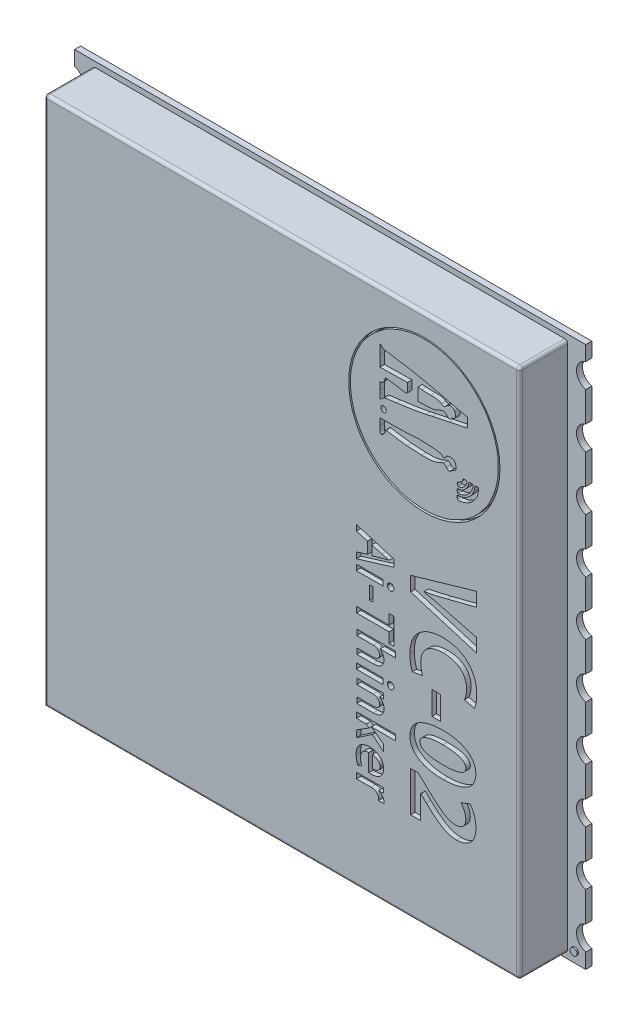
from build123d import *

# Parameters (mm, degrees)
BOSS_EXTRU_1_DEPTH      = 0.2
ESQUISSE2_W             = 15.803114296
ESQUISSE2_H             = 17.642374152
BOSS_EXTRU_2_DEPTH      = 1.6
CONG_1_R                = 0.1
ESQUISSE3_R             = 0.116493482
BOSS_EXTRU_3_DEPTH      = 0.05
ESQUISSE4_R             = 2.51604022
ENL_V_MAT_EXTRU_1_DEPTH = 0.15
ESQUISSE5_W             = 0.778452864
ESQUISSE5_H             = 0.285159829
ENL_V_MAT_EXTRU_2_DEPTH = 0.15
ESQUISSE6_W             = 0.190537595
ESQUISSE6_H             = 0.895310767
ESQUISSE6_W_2           = 0.446033444
ESQUISSE6_H_2           = 0.118264801
ENL_V_MAT_EXTRU_3_DEPTH = 0.15


with BuildPart() as part:
    # Esquisse1 → Boss.-Extru.1 (new body)
    with BuildSketch(Plane.XY):
        with BuildLine():
            Line((-8.5, -9), (8.5, -9))
            Line((8.5, -9), (8.5, -8.495815854))
            ThreePointArc((8.5, -8.495815854), (8.192365076, -8.092917147), (8.5, -7.690018439))
            Line((8.5, -7.690018439), (8.5, -6.695815854))
            ThreePointArc((8.5, -6.695815854), (8.192365076, -6.292917147), (8.5, -5.890018439))
            Line((8.5, -5.890018439), (8.5, -4.895815854))
            ThreePointArc((8.5, -4.895815854), (8.192365076, -4.492917147), (8.5, -4.090018439))
            Line((8.5, -4.090018439), (8.5, -3.095815854))
            ThreePointArc((8.5, -3.095815854), (8.192365076, -2.692917147), (8.5, -2.290018439))
            Line((8.5, -2.290018439), (8.5, -1.295815854))
            ThreePointArc((8.5, -1.295815854), (8.192365076, -0.892917147), (8.5, -0.490018439))
            Line((8.5, -0.490018439), (8.5, 0.504184146))
            ThreePointArc((8.5, 0.504184146), (8.192365076, 0.907082853), (8.5, 1.309981561))
            Line((8.5, 1.309981561), (8.5, 2.304184146))
            ThreePointArc((8.5, 2.304184146), (8.192365076, 2.707082853), (8.5, 3.109981561))
            Line((8.5, 3.109981561), (8.5, 4.104184146))
            ThreePointArc((8.5, 4.104184146), (8.192365076, 4.507082853), (8.5, 4.909981561))
            Line((8.5, 4.909981561), (8.5, 5.904184146))
            ThreePointArc((8.5, 5.904184146), (8.192365076, 6.307082853), (8.5, 6.709981561))
            Line((8.5, 6.709981561), (8.5, 7.704184146))
            ThreePointArc((8.5, 7.704184146), (8.192365076, 8.107082853), (8.5, 8.509981561))
            Line((8.5, 8.509981561), (8.5, 9))
            Line((8.5, 9), (-8.5, 9))
            Line((-8.5, 9), (-8.5, 8.509981561))
            ThreePointArc((-8.5, 8.509981561), (-8.192365076, 8.107082853), (-8.5, 7.704184146))
            Line((-8.5, 7.704184146), (-8.5, 6.709981561))
            ThreePointArc((-8.5, 6.709981561), (-8.192365076, 6.307082853), (-8.5, 5.904184146))
            Line((-8.5, 5.904184146), (-8.5, 4.909981561))
            ThreePointArc((-8.5, 4.909981561), (-8.192365076, 4.507082853), (-8.5, 4.104184146))
            Line((-8.5, 4.104184146), (-8.5, 3.109981561))
            ThreePointArc((-8.5, 3.109981561), (-8.192365076, 2.707082853), (-8.5, 2.304184146))
            Line((-8.5, 2.304184146), (-8.5, 1.309981561))
            ThreePointArc((-8.5, 1.309981561), (-8.192365076, 0.907082853), (-8.5, 0.504184146))
            Line((-8.5, 0.504184146), (-8.5, -0.490018439))
            ThreePointArc((-8.5, -0.490018439), (-8.192365076, -0.892917147), (-8.5, -1.295815854))
            Line((-8.5, -1.295815854), (-8.5, -2.290018439))
            ThreePointArc((-8.5, -2.290018439), (-8.192365076, -2.692917147), (-8.5, -3.095815854))
            Line((-8.5, -3.095815854), (-8.5, -4.090018439))
            ThreePointArc((-8.5, -4.090018439), (-8.192365076, -4.492917147), (-8.5, -4.895815854))
            Line((-8.5, -4.895815854), (-8.5, -5.890018439))
            ThreePointArc((-8.5, -5.890018439), (-8.192365076, -6.292917147), (-8.5, -6.695815854))
            Line((-8.5, -6.695815854), (-8.5, -7.690018439))
            ThreePointArc((-8.5, -7.690018439), (-8.192365076, -8.092917147), (-8.5, -8.495815854))
            Line((-8.5, -8.495815854), (-8.5, -9))
        make_face()
    extrude(amount=BOSS_EXTRU_1_DEPTH)

    # Esquisse2 → Boss.-Extru.2 (add)
    with BuildSketch(Plane.XY.offset(0.2)):
        Rectangle(ESQUISSE2_W, ESQUISSE2_H)
    extrude(amount=BOSS_EXTRU_2_DEPTH)

    # Congé1
    cong_1_edges = [part.edges().sort_by_distance(p)[0] for p in [
        (7.901557148, -8.821187076, 1),
        (-7.901557148, 8.821187076, 1),
        (7.901557148, 8.821187076, 1),
        (0, 8.821187076, 1.8),
        (7.901557148, 0, 1.8),
        (0, -8.821187076, 1.8),
        (-7.901557148, 0, 1.8),
    ]]
    fillet(cong_1_edges, radius=CONG_1_R)

    # Esquisse3 → Boss.-Extru.3 (add)
    with BuildSketch(Plane.XY.offset(0.2)):
        with Locations((8.142946919, -8.644375793)):
            Circle(ESQUISSE3_R)
    extrude(amount=BOSS_EXTRU_3_DEPTH)

    # Esquisse4 → Enlèv. mat.-Extru.1 (cut)
    # profile 1 of 7: a face of its own
    with BuildSketch(Plane(origin=(4.077832709, 3.569616169, 1.8), x_dir=(0, -1, 0), z_dir=(0, 0, 1))):
        with Locations((-2.032866157, 0.653421265)):
            Circle(ESQUISSE4_R)
        with BuildLine():
            add(Edge.make_bspline(
                [(-1.438084741, -1.726497797), (-1.667747991, -1.793112797), (-1.984358491, -1.819272047), (-2.266952991, -1.794980797)],
                knots=[0, 0, 0, 0, 1, 1, 1, 1], degree=3))
            add(Edge.make_bspline(
                [(-2.266952991, -1.794980797), (-2.410836491, -1.782613047), (-2.488838491, -1.768228547), (-2.734293491, -1.708798047)],
                knots=[0, 0, 0, 0, 1, 1, 1, 1], degree=3))
            add(Edge.make_bspline(
                [(-2.734293491, -1.708798047), (-2.884789741, -1.672359547), (-3.279960241, -1.489848797), (-3.395100741, -1.403602297)],
                knots=[0, 0, 0, 0, 1, 1, 1, 1], degree=3))
            add(Edge.make_bspline(
                [(-3.395100741, -1.403602297), (-3.423911241, -1.382021797), (-3.499302991, -1.325549047), (-3.562637741, -1.278107797)],
                knots=[0, 0, 0, 0, 1, 1, 1, 1], degree=3))
            add(Edge.make_bspline(
                [(-3.562637741, -1.278107797), (-3.717159991, -1.162362297), (-3.883622241, -0.990693047), (-4.017665991, -0.808846797)],
                knots=[0, 0, 0, 0, 1, 1, 1, 1], degree=3))
            add(Edge.make_bspline(
                [(-4.017665991, -0.808846797), (-4.078438991, -0.726400797), (-4.135252741, -0.650105547), (-4.143918241, -0.639301547)],
                knots=[0, 0, 0, 0, 1, 1, 1, 1], degree=3))
            add(Edge.make_bspline(
                [(-4.143918241, -0.639301547), (-4.175609241, -0.599790547), (-4.336371741, -0.250348547), (-4.370166741, -0.147515797)],
                knots=[0, 0, 0, 0, 1, 1, 1, 1], degree=3))
            add(Edge.make_bspline(
                [(-4.370166741, -0.147515797), (-4.476968491, 0.177464203), (-4.502132741, 0.330473953), (-4.502132741, 0.979324203), (-4.476968491, 1.132334203), (-4.370166741, 1.457314203)],
                knots=[0, 0, 0, 0, 1, 1, 1.999999229, 1.999999229, 1.999999229, 1.999999229], degree=3))
            add(Edge.make_bspline(
                [(-4.370166741, 1.457314203), (-4.328578241, 1.583861203), (-4.169041241, 1.920901453), (-4.120718741, 1.969223953), (-4.100542991, 1.997548703), (-4.089434991, 2.018616203)],
                knots=[0, 0, 0, 0, 1, 1, 1.389735699, 1.389735699, 1.389735699, 1.389735699], degree=3))
            add(Edge.make_bspline(
                [(-4.089434991, 2.018616203), (-3.994602741, 2.198479953), (-3.590090241, 2.602992703), (-3.410226491, 2.697825203)],
                knots=[0, 0, 0, 0, 1, 1, 1, 1], degree=3))
            add(Edge.make_bspline(
                [(-3.410226491, 2.697825203), (-3.389158741, 2.708932703), (-3.360833991, 2.729108703), (-3.312511741, 2.777430953), (-2.975471241, 2.936967953), (-2.848924241, 2.978556703)],
                knots=[0, 0, 0, 0, 1, 1, 3.56575719, 3.56575719, 3.56575719, 3.56575719], degree=3))
            add(Edge.make_bspline(
                [(-2.848924241, 2.978556703), (-2.523944191, 3.0853583), (-2.370934429, 3.110522477), (-2.046509429, 3.110522324)],
                knots=[0, 0, 0, 0, 1, 1, 1, 1], degree=3))
            add(Edge.make_bspline(
                [(-2.046509429, 3.110522324), (-1.722084179, 3.110522188), (-1.569074189, 3.085357874), (-1.244094484, 2.978555988)],
                knots=[0, 0, 0, 0, 1, 1, 1, 1], degree=3))
            add(Edge.make_bspline(
                [(-1.244094484, 2.978555988), (-1.141261484, 2.944760738), (-0.791819484, 2.783998238), (-0.752308734, 2.752307488)],
                knots=[0, 0, 0, 0, 1, 1, 1, 1], degree=3))
            add(Edge.make_bspline(
                [(-0.752308734, 2.752307488), (-0.741504734, 2.743641738), (-0.665209234, 2.686828238), (-0.582763234, 2.626055238)],
                knots=[0, 0, 0, 0, 1, 1, 1, 1], degree=3))
            add(Edge.make_bspline(
                [(-0.582763234, 2.626055238), (-0.400916984, 2.492011488), (-0.229247734, 2.325548988), (-0.113502484, 2.171027238)],
                knots=[0, 0, 0, 0, 1, 1, 1, 1], degree=3))
            add(Edge.make_bspline(
                [(-0.113502484, 2.171027238), (-0.066060984, 2.107691988), (-0.009588484, 2.032300238), (0.011992016, 2.003489988)],
                knots=[0, 0, 0, 0, 1, 1, 1, 1], degree=3))
            add(Edge.make_bspline(
                [(0.011992016, 2.003489988), (0.098238516, 1.888349488), (0.280749266, 1.493178988), (0.317188016, 1.342682738)],
                knots=[0, 0, 0, 0, 1, 1, 1, 1], degree=3))
            add(Edge.make_bspline(
                [(0.317188016, 1.342682738), (0.374994766, 1.103933238), (0.390180516, 1.016747238), (0.403962516, 0.844479988)],
                knots=[0, 0, 0, 0, 1, 1, 1, 1], degree=3))
            add(Edge.make_bspline(
                [(0.403962516, 0.844479988), (0.430218266, 0.516297988), (0.371000766, 0.063961738), (0.269478266, -0.182787512)],
                knots=[0, 0, 0, 0, 1, 1, 1, 1], degree=3))
            add(Edge.make_bspline(
                [(0.269478266, -0.182787512), (0.061592769, -0.688051117), (-0.200876807, -1.034746248), (-0.600398159, -1.331804198)],
                knots=[0, 0, 0, 0, 1, 1, 1, 1], degree=3))
            add(Edge.make_bspline(
                [(-0.600398159, -1.331804198), (-0.795155138, -1.476612139), (-1.172994192, -1.66785629), (-1.326023991, -1.699081547)],
                knots=[0, 0, 0, 0, 1, 1, 1, 1], degree=3))
            add(Edge.make_bspline(
                [(-1.326023991, -1.699081547), (-1.358558741, -1.705720297), (-1.408986241, -1.718057547), (-1.438084741, -1.726497797)],
                knots=[0, 0, 0, 0, 1, 1, 1, 1], degree=3))
        make_face(mode=Mode.SUBTRACT)
    # profile 2 of 7: a face of its own
    with BuildSketch(Plane(origin=(4.077832709, 3.569616169, 1.8), x_dir=(0, -1, 0), z_dir=(0, 0, 1))):
        with BuildLine():
            add(Edge.make_bspline(
                [(-0.771251734, 2.366329238), (-0.867348984, 2.427020238), (-0.904545734, 2.439979738), (-1.007389984, 2.448601988)],
                knots=[0, 0, 0, 0, 1, 1, 1, 1], degree=3))
            Line((-1.007389984, 2.448601988), (-1.129463734, 2.458834488))
            Line((-1.129463734, 2.458834488), (-1.129463734, 2.397008988))
            add(Edge.make_bspline(
                [(-1.129463734, 2.397008988), (-1.129463734, 2.336081988), (-1.128198984, 2.335033488), (-1.042492234, 2.324882738)],
                knots=[0, 0, 0, 0, 1, 1, 1, 1], degree=3))
            add(Edge.make_bspline(
                [(-1.042492234, 2.324882738), (-0.807334734, 2.297031738), (-0.594819734, 2.079399238), (-0.569875984, 1.840885488)],
                knots=[0, 0, 0, 0, 1, 1, 1, 1], degree=3))
            Line((-0.569875984, 1.840885488), (-0.560193234, 1.748298988))
            Line((-0.560193234, 1.748298988), (-0.492118734, 1.748298988))
            add(Edge.make_bspline(
                [(-0.492118734, 1.748298988), (-0.427034234, 1.748298988), (-0.424052484, 1.750816488), (-0.424234734, 1.805614488)],
                knots=[0, 0, 0, 0, 1, 1, 1, 1], degree=3))
            add(Edge.make_bspline(
                [(-0.424234734, 1.805614488), (-0.424466234, 1.875450238), (-0.461648984, 2.002039238), (-0.509021984, 2.094282988)],
                knots=[0, 0, 0, 0, 1, 1, 1, 1], degree=3))
            add(Edge.make_bspline(
                [(-0.509021984, 2.094282988), (-0.564200234, 2.201725488), (-0.647572234, 2.288218738), (-0.771251734, 2.366329238)],
                knots=[0, 0, 0, 0, 1, 1, 1, 1], degree=3))
        make_face()
    # profile 3 of 7: a face of its own
    with BuildSketch(Plane(origin=(4.077832709, 3.569616169, 1.8), x_dir=(0, -1, 0), z_dir=(0, 0, 1))):
        with BuildLine():
            add(Edge.make_bspline(
                [(-1.520392984, 0.196375488), (-1.509917484, 0.094530488), (-1.501000734, -0.177276512), (-1.500577984, -0.407640012)],
                knots=[0, 0, 0, 0, 1, 1, 1, 1], degree=3))
            Line((-1.500577984, -0.407640012), (-1.499809234, -0.826483012))
            Line((-1.499809234, -0.826483012), (-1.270547734, -0.826483012))
            add(Edge.make_bspline(
                [(-1.270547734, -0.826483012), (-1.042512234, -0.826483012), (-1.041286484, -0.826264762), (-1.041286484, -0.785574762)],
                knots=[0, 0, 0, 0, 1, 1, 1, 1], degree=3))
            add(Edge.make_bspline(
                [(-1.041286484, -0.785574762), (-1.041286234, -0.730362762), (-1.160726234, -0.632492762), (-1.247973734, -0.632492762), (-1.253110234, -0.623175012), (-1.244956734, -0.601927262)],
                knots=[0, 0, 0, 0, 1, 1, 1.29485272, 1.29485272, 1.29485272, 1.29485272], degree=3))
            add(Edge.make_bspline(
                [(-1.244956734, -0.601927262), (-1.227306234, -0.555931012), (-1.166875734, -0.147705512), (-1.144410234, 0.077292488)],
                knots=[0, 0, 0, 0, 1, 1, 1, 1], degree=3))
            add(Edge.make_bspline(
                [(-1.144410234, 0.077292488), (-1.133512484, 0.186435988), (-1.121182984, 0.405180988), (-1.117011234, 0.563392488)],
                knots=[0, 0, 0, 0, 1, 1, 1, 1], degree=3))
            add(Edge.make_bspline(
                [(-1.117011234, 0.563392488), (-1.108763484, 0.876185988), (-1.125075234, 0.984084488), (-1.209453484, 1.174878738)],
                knots=[0, 0, 0, 0, 1, 1, 1, 1], degree=3))
            add(Edge.make_bspline(
                [(-1.209453484, 1.174878738), (-1.233355734, 1.228925988), (-1.252912234, 1.283868488), (-1.252912234, 1.310078238), (-1.221168234, 1.348625738), (-1.182370234, 1.382634738)],
                knots=[0, 0, 0, 0, 1, 1, 1.999980923, 1.999980923, 1.999980923, 1.999980923], degree=3))
            add(Edge.make_bspline(
                [(-1.182370234, 1.382634738), (-1.102738234, 1.452436738), (-1.095656984, 1.485692738), (-1.148474484, 1.541819488)],
                knots=[0, 0, 0, 0, 1, 1, 1, 1], degree=3))
            add(Edge.make_bspline(
                [(-1.148474484, 1.541819488), (-1.168629984, 1.563237738), (-1.195681484, 1.605789238), (-1.208588734, 1.636377988)],
                knots=[0, 0, 0, 0, 1, 1, 1, 1], degree=3))
            add(Edge.make_bspline(
                [(-1.208588734, 1.636377988), (-1.235944234, 1.701206488), (-1.281639734, 1.720244738), (-1.372695484, 1.704749488)],
                knots=[0, 0, 0, 0, 1, 1, 1, 1], degree=3))
            add(Edge.make_bspline(
                [(-1.372695484, 1.704749488), (-1.470480984, 1.688109238), (-1.518277484, 1.643662988), (-1.529661984, 1.558786238)],
                knots=[0, 0, 0, 0, 1, 1, 1, 1], degree=3))
            add(Edge.make_bspline(
                [(-1.529661984, 1.558786238), (-1.543477234, 1.455785738), (-1.525337984, 1.402245988), (-1.464437234, 1.366271238)],
                knots=[0, 0, 0, 0, 1, 1, 1, 1], degree=3))
            add(Edge.make_bspline(
                [(-1.464437234, 1.366271238), (-1.412254234, 1.335445738), (-1.394938234, 1.284539488), (-1.429392484, 1.263245238)],
                knots=[0, 0, 0, 0, 1, 1, 1, 1], degree=3))
            add(Edge.make_bspline(
                [(-1.429392484, 1.263245238), (-1.488115984, 1.226952238), (-1.507884234, 1.135218738), (-1.522485734, 0.831253238)],
                knots=[0, 0, 0, 0, 1, 1, 1, 1], degree=3))
            add(Edge.make_bspline(
                [(-1.522485734, 0.831253238), (-1.542315234, 0.418453738), (-1.542284734, 0.409213488), (-1.520392984, 0.196375488)],
                knots=[0, 0, 0, 0, 1, 1, 1, 1], degree=3))
        make_face()
    # profile 4 of 7: a face of its own
    with BuildSketch(Plane(origin=(4.077832709, 3.569616169, 1.8), x_dir=(0, -1, 0), z_dir=(0, 0, 1))):
        with BuildLine():
            Line((-2.959129984, -0.826483012), (-2.974353984, 0.090562488))
            Line((-2.974353984, 0.090562488), (-2.810234984, 0.090562488))
            add(Edge.make_bspline(
                [(-2.810234984, 0.090562488), (-2.622148484, 0.090562488), (-2.630427484, 0.101119988), (-2.665022984, -0.094610012)],
                knots=[0, 0, 0, 0, 1, 1, 1, 1], degree=3))
            add(Edge.make_bspline(
                [(-2.665022984, -0.094610012), (-2.675309484, -0.152807262), (-2.691148734, -0.252006762), (-2.700221234, -0.315053762)],
                knots=[0, 0, 0, 0, 1, 1, 1, 1], degree=3))
            add(Edge.make_bspline(
                [(-2.700221234, -0.315053762), (-2.709293984, -0.378100512), (-2.723645484, -0.473332262), (-2.732113484, -0.526679762)],
                knots=[0, 0, 0, 0, 1, 1, 1, 1], degree=3))
            add(Edge.make_bspline(
                [(-2.732113484, -0.526679762), (-2.748922484, -0.632573262), (-2.745268984, -0.650128262), (-2.692236734, -0.650128262), (-2.648414984, -0.671447762), (-2.609039484, -0.697505012)],
                knots=[0, 0, 0, 0, 1, 1, 1.365139327, 1.365139327, 1.365139327, 1.365139327], degree=3))
            add(Edge.make_bspline(
                [(-2.609039484, -0.697505012), (-2.552457984, -0.734948762), (-2.539083734, -0.753436012), (-2.545247984, -0.785682512)],
                knots=[0, 0, 0, 0, 1, 1, 1, 1], degree=3))
            Line((-2.545247984, -0.785682512), (-2.553047734, -0.826483012))
            Line((-2.553047734, -0.826483012), (-2.289919984, -0.826483012))
            add(Edge.make_bspline(
                [(-2.289919984, -0.826483012), (-2.008202984, -0.826483012), (-2.004063984, -0.824650262), (-2.101198984, -0.742916762)],
                knots=[0, 0, 0, 0, 1, 1, 1, 1], degree=3))
            add(Edge.make_bspline(
                [(-2.101198984, -0.742916762), (-2.131974234, -0.717021012), (-2.151690484, -0.679805012), (-2.157368484, -0.636891512)],
                knots=[0, 0, 0, 0, 1, 1, 1, 1], degree=3))
            add(Edge.make_bspline(
                [(-2.157368484, -0.636891512), (-2.162180734, -0.600523762), (-2.183310734, -0.439824762), (-2.204324484, -0.279782762)],
                knots=[0, 0, 0, 0, 1, 1, 1, 1], degree=3))
            add(Edge.make_bspline(
                [(-2.204324484, -0.279782762), (-2.263609484, 0.171737988), (-2.325412484, 0.554739738), (-2.363686234, 0.707804988)],
                knots=[0, 0, 0, 0, 1, 1, 1, 1], degree=3))
            add(Edge.make_bspline(
                [(-2.363686234, 0.707804988), (-2.372174984, 0.741753238), (-2.392285734, 0.833016738), (-2.408376484, 0.910612988)],
                knots=[0, 0, 0, 0, 1, 1, 1, 1], degree=3))
            add(Edge.make_bspline(
                [(-2.408376484, 0.910612988), (-2.438024984, 1.053587238), (-2.483800484, 1.267996738), (-2.532625734, 1.492584488)],
                knots=[0, 0, 0, 0, 1, 1, 1, 1], degree=3))
            add(Edge.make_bspline(
                [(-2.532625734, 1.492584488), (-2.577044984, 1.696904738), (-2.609815984, 1.856772738), (-2.631137234, 1.973151488)],
                knots=[0, 0, 0, 0, 1, 1, 1, 1], degree=3))
            Line((-2.631137234, 1.973151488), (-2.651329984, 2.083373488))
            Line((-2.651329984, 2.083373488), (-2.811851484, 2.083363988))
            Line((-2.811851484, 2.083363988), (-2.972372734, 2.083354488))
            Line((-2.972372734, 2.083354488), (-3.014238234, 1.893782238))
            add(Edge.make_bspline(
                [(-3.014238234, 1.893782238), (-3.037264484, 1.789517738), (-3.062553734, 1.680402488), (-3.070436984, 1.651303738)],
                knots=[0, 0, 0, 0, 1, 1, 1, 1], degree=3))
            add(Edge.make_bspline(
                [(-3.070436984, 1.651303738), (-3.114024484, 1.490411238), (-3.164895234, 1.284640488), (-3.185973234, 1.183963238)],
                knots=[0, 0, 0, 0, 1, 1, 1, 1], degree=3))
            add(Edge.make_bspline(
                [(-3.185973234, 1.183963238), (-3.199172734, 1.120916238), (-3.222385234, 1.017748738), (-3.237556734, 0.954701738)],
                knots=[0, 0, 0, 0, 1, 1, 1, 1], degree=3))
            add(Edge.make_bspline(
                [(-3.237556734, 0.954701738), (-3.252728234, 0.891654988), (-3.276481984, 0.784519238), (-3.290342734, 0.716622488)],
                knots=[0, 0, 0, 0, 1, 1, 1, 1], degree=3))
            add(Edge.make_bspline(
                [(-3.290342734, 0.716622488), (-3.304203484, 0.648725988), (-3.328136234, 0.533654488), (-3.343526984, 0.460907988)],
                knots=[0, 0, 0, 0, 1, 1, 1, 1], degree=3))
            add(Edge.make_bspline(
                [(-3.343526984, 0.460907988), (-3.391653484, 0.233427988), (-3.405995734, 0.151261988), (-3.458963484, -0.200423012)],
                knots=[0, 0, 0, 0, 1, 1, 1, 1], degree=3))
            add(Edge.make_bspline(
                [(-3.458963484, -0.200423012), (-3.477954734, -0.326516762), (-3.501232484, -0.467985762), (-3.510691734, -0.514798512)],
                knots=[0, 0, 0, 0, 1, 1, 1, 1], degree=3))
            add(Edge.make_bspline(
                [(-3.510691734, -0.514798512), (-3.520151234, -0.561611262), (-3.527890734, -0.623899012), (-3.527890734, -0.689702012), (-3.544582734, -0.722111512), (-3.580797234, -0.755941012)],
                knots=[0, 0, 0, 0, 1, 1, 2.244553029, 2.244553029, 2.244553029, 2.244553029], degree=3))
            add(Edge.make_bspline(
                [(-3.580797234, -0.755941012), (-3.609895984, -0.783123262), (-3.633703734, -0.810115262), (-3.633703734, -0.821730762), (-3.481924484, -0.826483012), (-3.296416734, -0.826483012)],
                knots=[0, 0, 0, 0, 1, 1, 1.999913912, 1.999913912, 1.999913912, 1.999913912], degree=3))
            Line((-3.296416734, -0.826483012), (-2.959129984, -0.826483012))
        make_face()
        with BuildLine():
            add(Edge.make_bspline(
                [(-2.700473234, 1.142457488), (-2.639976984, 1.034748488), (-2.610845234, 0.875815238), (-2.610845234, 0.653473988)],
                knots=[0, 0, 0, 0, 1, 1, 1, 1], degree=3))
            Line((-2.610845234, 0.653473988), (-2.610845234, 0.443272488))
            Line((-2.610845234, 0.443272488), (-3.019268984, 0.443272488))
            Line((-3.019268984, 0.443272488), (-3.005281734, 0.562311988))
            add(Edge.make_bspline(
                [(-3.005281734, 0.562311988), (-2.997588734, 0.627783738), (-2.992835484, 0.764679238), (-2.994718484, 0.866524238)],
                knots=[0, 0, 0, 0, 1, 1, 1, 1], degree=3))
            add(Edge.make_bspline(
                [(-2.994718484, 0.866524238), (-2.998261984, 1.058181738), (-2.982063484, 1.141766988), (-2.925835984, 1.221956738)],
                knots=[0, 0, 0, 0, 1, 1, 1, 1], degree=3))
            add(Edge.make_bspline(
                [(-2.925835984, 1.221956738), (-2.878343734, 1.289688488), (-2.885047484, 1.331189988), (-3.043822234, 1.489964738), (-3.036557984, 1.598654238), (-2.937424234, 1.659922238)],
                knots=[0, 0, 0, 0, 1, 1, 2.278308503, 2.278308503, 2.278308503, 2.278308503], degree=3))
            add(Edge.make_bspline(
                [(-2.937424234, 1.659922238), (-2.834018484, 1.723830488), (-2.699022734, 1.691770488), (-2.699022734, 1.588131738), (-2.687049984, 1.571123488), (-2.657783484, 1.559892988), (-2.636738484, 1.535386488), (-2.625649734, 1.511049238)],
                knots=[0, 0, 0, 0, 1, 1, 1.171509393, 1.171509393, 1.343018787, 1.343018787, 1.343018787, 1.343018787], degree=3))
            add(Edge.make_bspline(
                [(-2.625649734, 1.511049238), (-2.607182484, 1.470518238), (-2.611781984, 1.461283238), (-2.680387734, 1.401146238)],
                knots=[0, 0, 0, 0, 1, 1, 1, 1], degree=3))
            add(Edge.make_bspline(
                [(-2.680387734, 1.401146238), (-2.749866984, 1.340243488), (-2.754515234, 1.330664238), (-2.744618984, 1.268776738)],
                knots=[0, 0, 0, 0, 1, 1, 1, 1], degree=3))
            add(Edge.make_bspline(
                [(-2.744618984, 1.268776738), (-2.738751234, 1.232082988), (-2.718885734, 1.175239488), (-2.700473234, 1.142457488)],
                knots=[0, 0, 0, 0, 1, 1, 1, 1], degree=3))
        make_face(mode=Mode.SUBTRACT)
    # profile 5 of 7: a face of its own
    with BuildSketch(Plane(origin=(4.077832709, 3.569616169, 1.8), x_dir=(0, -1, 0), z_dir=(0, 0, 1))):
        with BuildLine():
            add(Edge.make_bspline(
                [(-1.887169484, -0.757100512), (-1.858511484, -0.810648262), (-1.751797984, -0.804047762), (-1.725861734, -0.747123262)],
                knots=[0, 0, 0, 0, 1, 1, 1, 1], degree=3))
            add(Edge.make_bspline(
                [(-1.725861734, -0.747123262), (-1.695287484, -0.680020762), (-1.730815234, -0.614857012), (-1.886144984, -0.614857012), (-1.927769734, -0.681238262), (-1.887169484, -0.757100512)],
                knots=[0, 0, 0, 0, 1, 1, 2.312857127, 2.312857127, 2.312857127, 2.312857127], degree=3))
        make_face()
    # profile 6 of 7: a face of its own
    with BuildSketch(Plane(origin=(4.077832709, 3.569616169, 1.8), x_dir=(0, -1, 0), z_dir=(0, 0, 1))):
        with BuildLine():
            add(Edge.make_bspline(
                [(-0.853761734, 1.898237488), (-0.905174734, 1.996434738), (-1.000173984, 2.065737988), (-1.124291984, 2.065737988), (-1.129463734, 2.058812738), (-1.129463734, 1.959190238), (-1.121737484, 1.942289488), (-1.060266484, 1.942289488), (-0.953108734, 1.828753238), (-0.953108734, 1.754702738), (-0.942340234, 1.748298988), (-0.848993234, 1.748298988), (-0.824854484, 1.757938488), (-0.817283234, 1.777668738)],
                knots=[0, 0, 0, 0, 1, 1, 1.491923924, 1.491923924, 1.894299004, 1.894299004, 2.699039346, 2.699039346, 3.266748746, 3.266748746, 3.727863671, 3.727863671, 3.727863671, 3.727863671], degree=3))
            add(Edge.make_bspline(
                [(-0.817283234, 1.777668738), (-0.810819484, 1.794513738), (-0.826375234, 1.845929738), (-0.853761734, 1.898237488)],
                knots=[0, 0, 0, 0, 1, 1, 1, 1], degree=3))
        make_face()
    # profile 7 of 7: a face of its own
    with BuildSketch(Plane(origin=(4.077832709, 3.569616169, 1.8), x_dir=(0, -1, 0), z_dir=(0, 0, 1))):
        with BuildLine():
            add(Edge.make_bspline(
                [(-1.065568234, 2.128218488), (-0.906658234, 2.098406738), (-0.759118234, 1.941304988), (-0.759118234, 1.751121238), (-0.755404734, 1.748298988), (-0.634196984, 1.748298988), (-0.618034234, 1.755105238), (-0.618034234, 1.794343738), (-0.631492984, 1.855847738), (-0.647942734, 1.914680988)],
                knots=[0, 0, 0, 0, 1, 1, 1.364334176, 1.364334176, 1.660797799, 1.660797799, 1.872338362, 1.872338362, 1.872338362, 1.872338362], degree=3))
            add(Edge.make_bspline(
                [(-0.647942734, 1.914680988), (-0.671802484, 2.000015988), (-0.695876734, 2.039481988), (-0.766982234, 2.109826738)],
                knots=[0, 0, 0, 0, 1, 1, 1, 1], degree=3))
            add(Edge.make_bspline(
                [(-0.766982234, 2.109826738), (-0.856955734, 2.198837488), (-0.892644234, 2.220738738), (-1.007267234, 2.257284738)],
                knots=[0, 0, 0, 0, 1, 1, 1, 1], degree=3))
            add(Edge.make_bspline(
                [(-1.007267234, 2.257284738), (-1.114576734, 2.291498738), (-1.129463734, 2.285590238), (-1.129463734, 2.143926988), (-1.125996234, 2.139554738), (-1.065568234, 2.128218488)],
                knots=[0, 0, 0, 0, 1, 1, 1.844435475, 1.844435475, 1.844435475, 1.844435475], degree=3))
        make_face()
    extrude(amount=-ENL_V_MAT_EXTRU_1_DEPTH, mode=Mode.SUBTRACT)

    # Esquisse5 → Enlèv. mat.-Extru.2 (cut)
    # profile 1 of 5: a face of its own
    with BuildSketch(Plane(origin=(6.250409061, -0.922844274, 1.8), x_dir=(0, -1, 0), z_dir=(0, 0, 1))):
        with BuildLine():
            add(Edge.make_bspline(
                [(-1.526407641, -0.763089363), (-1.543427881, -0.825577027), (-1.577867189, -0.952016605), (-1.625416205, -1.144203659), (-1.669886535, -1.339008541), (-1.695491824, -1.470048434), (-1.708261674, -1.535400552)],
                knots=[0, 0, 0, 0, 0.979195494, 1.981336121, 2.993253465, 4, 4, 4, 4], degree=3))
            Line((-1.708261674, -1.535400552), (-1.716364286, -1.535400552))
            add(Edge.make_bspline(
                [(-1.716364286, -1.535400552), (-1.72901478, -1.469666629), (-1.754280144, -1.338383887), (-1.796044891, -1.142430366), (-1.841910003, -0.947659779), (-1.875449165, -0.818615734), (-1.892222283, -0.754080104)],
                knots=[0, 0, 0, 0, 1.002765459, 2.002707189, 3.001142984, 4, 4, 4, 4], degree=3))
            Line((-1.892222283, -0.754080104), (-2.138805183, 0.209094777))
            Line((-2.138805183, 0.209094777), (-2.598155755, 0.209094777))
            Line((-2.598155755, 0.209094777), (-1.965859581, -1.972972779))
            Line((-1.965859581, -1.972972779), (-1.486715207, -1.972972779))
            Line((-1.486715207, -1.972972779), (-0.823284536, 0.209094777))
            Line((-0.823284536, 0.209094777), (-1.274077172, 0.209094777))
            Line((-1.274077172, 0.209094777), (-1.526407641, -0.763089363))
        make_face()
    # profile 2 of 5: a face of its own
    with BuildSketch(Plane(origin=(6.250409061, -0.922844274, 1.8), x_dir=(0, -1, 0), z_dir=(0, 0, 1))):
        with BuildLine():
            add(Edge.make_bspline(
                [(0.807042032, 0.144959272), (0.797792688, 0.149434388), (0.777141788, 0.159425926), (0.740922864, 0.172435656), (0.696413447, 0.184558345), (0.643990104, 0.19763404), (0.583379835, 0.208402553), (0.51491482, 0.21719331), (0.438408051, 0.221606924), (0.38482321, 0.222843161), (0.356685915, 0.223492306)],
                knots=[0, 0, 0, 0, 0.535159811, 1.194845039, 2.001301056, 2.938542546, 4.009162703, 5.206971893, 6.533386393, 8, 8, 8, 8], degree=3))
            add(Edge.make_bspline(
                [(0.356685915, 0.223492306), (0.320178689, 0.222805923), (0.248420591, 0.221456777), (0.143146626, 0.207831814), (0.042248819, 0.186404432), (-0.054220776, 0.155459564), (-0.146263916, 0.115591168), (-0.233934126, 0.066999668), (-0.317167244, 0.009755969), (-0.382043559, -0.045062336), (-0.431252696, -0.092916923), (-0.466123695, -0.131417808), (-0.498440173, -0.172430608), (-0.528376757, -0.215631769), (-0.556324816, -0.260867025), (-0.582319443, -0.308273808), (-0.605000399, -0.358478728), (-0.62592472, -0.410554974), (-0.644956544, -0.464746736), (-0.66111929, -0.521459685), (-0.675674705, -0.580142526), (-0.686780581, -0.641394277), (-0.696999352, -0.70455735), (-0.703563084, -0.770245404), (-0.708672386, -0.838004316), (-0.710230718, -0.883949953), (-0.711023096, -0.907312326)],
                knots=[0, 0, 0, 0, 1.497846589, 2.944146442, 4.349381705, 5.726914148, 7.095336494, 8.460401702, 9.835010851, 11.235407104, 11.941048584, 12.651505876, 13.365933221, 14.082841643, 14.80781453, 15.547825365, 16.300364481, 17.067585644, 17.851220897, 18.65668949, 19.487453629, 20.331856677, 21.21113844, 22.113144226, 23.040574248, 24, 24, 24, 24], degree=3))
            add(Edge.make_bspline(
                [(-0.711023096, -0.907312326), (-0.710140183, -0.947225942), (-0.708415081, -1.025212183), (-0.695458538, -1.139202834), (-0.674681831, -1.247166224), (-0.646145858, -1.349289736), (-0.609208208, -1.445240742), (-0.563916275, -1.53514834), (-0.510426489, -1.618932421), (-0.449577274, -1.696693042), (-0.38048994, -1.766414209), (-0.304363679, -1.828233753), (-0.220104372, -1.879854053), (-0.128894479, -1.92250817), (-0.030710049, -1.956910076), (0.075003259, -1.980946569), (0.187829772, -1.996881801), (0.265537984, -1.999762509), (0.305471938, -2.001242895)],
                knots=[0, 0, 0, 0, 1.135155834, 2.21795336, 3.258678792, 4.259742725, 5.230071044, 6.178653849, 7.118381509, 8.053327381, 8.981810473, 9.904603547, 10.83607254, 11.784917815, 12.764101967, 13.789333928, 14.863947138, 16, 16, 16, 16], degree=3))
            add(Edge.make_bspline(
                [(0.305471938, -2.001242895), (0.332791796, -2.000600362), (0.385560497, -1.9993593), (0.461878957, -1.994695342), (0.532569278, -1.986489897), (0.597362814, -1.975538763), (0.655566384, -1.962547767), (0.706341124, -1.948530949), (0.749875229, -1.934926646), (0.775235223, -1.92309574), (0.78688333, -1.917661683)],
                knots=[0, 0, 0, 0, 1.333126408, 2.574952836, 3.728647213, 4.803171329, 5.779491705, 6.636152101, 7.373570612, 8, 8, 8, 8], degree=3))
            Line((0.78688333, -1.917661683), (0.72774679, -1.576375735))
            add(Edge.make_bspline(
                [(0.72774679, -1.576375735), (0.716248091, -1.581058564), (0.692421415, -1.590761945), (0.65399292, -1.602328912), (0.612215259, -1.61311564), (0.551254722, -1.624878273), (0.471372553, -1.63599263), (0.40630518, -1.637757634), (0.3734841, -1.638647931)],
                knots=[0, 0, 0, 0, 0.6174215, 1.279371091, 1.994627391, 2.763548181, 4.367479155, 6, 6, 6, 6], degree=3))
            add(Edge.make_bspline(
                [(0.3734841, -1.638647931), (0.349283204, -1.637979529), (0.301939474, -1.636671947), (0.232901144, -1.627602429), (0.167768415, -1.612582041), (0.106723446, -1.591053925), (0.049513007, -1.564014073), (-0.003840817, -1.531087747), (-0.052877688, -1.491684864), (-0.098070082, -1.446700833), (-0.138245581, -1.395517576), (-0.17373374, -1.33904689), (-0.203814874, -1.276842064), (-0.227488858, -1.208728928), (-0.247512477, -1.135741244), (-0.261082106, -1.056983836), (-0.269723744, -0.972780125), (-0.271372129, -0.914708998), (-0.272221733, -0.884778176)],
                knots=[0, 0, 0, 0, 1.032508658, 2.019876005, 2.965519548, 3.879665312, 4.776351808, 5.660913147, 6.54825345, 7.454789282, 8.375818715, 9.318440911, 10.295818008, 11.316966534, 12.391302455, 13.521839484, 14.722714943, 16, 16, 16, 16], degree=3))
            add(Edge.make_bspline(
                [(-0.272221733, -0.884778176), (-0.271131013, -0.853068736), (-0.269019692, -0.791688367), (-0.259216519, -0.702790178), (-0.24372543, -0.620192208), (-0.222984957, -0.543787271), (-0.19696648, -0.473587604), (-0.164722729, -0.41010058), (-0.127555558, -0.352532755), (-0.084149389, -0.302140004), (-0.036849263, -0.257913508), (0.013364346, -0.21898841), (0.066687744, -0.186224194), (0.122907985, -0.159219935), (0.182180811, -0.138721762), (0.244428079, -0.124540208), (0.309449764, -0.115674599), (0.353789042, -0.114637823), (0.376352083, -0.114110236)],
                knots=[0, 0, 0, 0, 1.338543317, 2.591035429, 3.769939908, 4.881443291, 5.928300574, 6.923167432, 7.880641692, 8.812663106, 9.721865468, 10.609459092, 11.489159498, 12.357860959, 13.236352362, 14.129652843, 15.04823167, 16, 16, 16, 16], degree=3))
            add(Edge.make_bspline(
                [(0.376352083, -0.114110236), (0.394524803, -0.114462514), (0.42982397, -0.115146788), (0.481240512, -0.119354012), (0.529439523, -0.125649878), (0.57434354, -0.134925166), (0.616059197, -0.145424649), (0.654752983, -0.157582918), (0.690911768, -0.169907513), (0.713603081, -0.179788789), (0.724607133, -0.18458067)],
                knots=[0, 0, 0, 0, 1.218614231, 2.367068238, 3.457645391, 4.476038239, 5.440062936, 6.340987961, 7.195469468, 8, 8, 8, 8], degree=3))
            Line((0.724607133, -0.18458067), (0.807042032, 0.144959272))
        make_face()
    # profile 3 of 5: a face of its own
    with BuildSketch(Plane(origin=(6.250409061, -0.922844274, 1.8), x_dir=(0, -1, 0), z_dir=(0, 0, 1))):
        with Locations((1.357201988, -1.124869505)):
            Rectangle(ESQUISSE5_W, ESQUISSE5_H)
    # profile 4 of 5: a face of its own
    with BuildSketch(Plane(origin=(6.250409061, -0.922844274, 1.8), x_dir=(0, -1, 0), z_dir=(0, 0, 1))):
        with BuildLine():
            add(Edge.make_bspline(
                [(2.665453251, -1.999194336), (2.692813213, -1.998059509), (2.746401182, -1.995836807), (2.824334843, -1.981701745), (2.897537309, -1.958778611), (2.965875705, -1.926438647), (3.029305339, -1.885131196), (3.08802568, -1.835066279), (3.141417203, -1.77592752), (3.18969631, -1.708260122), (3.23329668, -1.632818231), (3.270204255, -1.549064548), (3.302328082, -1.458174115), (3.328270016, -1.359608136), (3.348692555, -1.253520701), (3.363151025, -1.139939423), (3.372304413, -1.01876632), (3.373564543, -0.935462927), (3.374213495, -0.892562701)],
                knots=[0, 0, 0, 0, 0.891408064, 1.745936256, 2.572046001, 3.384183195, 4.201267044, 5.031441608, 5.891421096, 6.790473701, 7.735400906, 8.72533739, 9.768215703, 10.873507909, 12.042938546, 13.285922414, 14.602283284, 16, 16, 16, 16], degree=3))
            add(Edge.make_bspline(
                [(3.374213495, -0.892562701), (3.374075947, -0.855402651), (3.37380615, -0.782513653), (3.366466118, -0.675463078), (3.355063956, -0.57278724), (3.337223292, -0.474755773), (3.314824817, -0.381279145), (3.287503191, -0.292131942), (3.254039959, -0.207844553), (3.216679367, -0.12788107), (3.172816959, -0.054901047), (3.122198913, 0.009630534), (3.06417585, 0.064016937), (3.000078538, 0.109889404), (2.928935811, 0.145588707), (2.851414415, 0.171740017), (2.767626371, 0.189376044), (2.709339944, 0.192965255), (2.679342242, 0.194812479)],
                knots=[0, 0, 0, 0, 1.232204757, 2.416955028, 3.556967175, 4.656941594, 5.719331404, 6.743729146, 7.746384706, 8.724983175, 9.668069731, 10.564373225, 11.435956103, 12.296892263, 13.169992217, 14.065276449, 15.004274861, 16, 16, 16, 16], degree=3))
            add(Edge.make_bspline(
                [(2.679342242, 0.194812479), (2.650312259, 0.193349331), (2.593592802, 0.190490598), (2.511697871, 0.174170904), (2.435401217, 0.149099315), (2.364561565, 0.114869262), (2.299409534, 0.07105592), (2.239978789, 0.018054713), (2.186256641, -0.044036122), (2.139128878, -0.115369531), (2.097257237, -0.193850819), (2.060769602, -0.278576826), (2.029995717, -0.369136392), (2.005191715, -0.465754277), (1.985701533, -0.568267828), (1.971240541, -0.676706574), (1.963233216, -0.79110511), (1.962104603, -0.869333741), (1.961527128, -0.909360885)],
                knots=[0, 0, 0, 0, 0.944846204, 1.846062465, 2.707557854, 3.552303352, 4.397866779, 5.254107521, 6.1362526, 7.061934359, 8.030246202, 9.027537041, 10.060510809, 11.139504921, 12.270844059, 13.454374221, 14.697482908, 16, 16, 16, 16], degree=3))
            add(Edge.make_bspline(
                [(1.961527128, -0.909360885), (1.96181314, -0.946657576), (1.962374242, -1.019826519), (1.969935994, -1.127186505), (1.98238141, -1.23010939), (2.000908589, -1.328295659), (2.024248196, -1.422198555), (2.052606545, -1.511656299), (2.087417273, -1.596187105), (2.126128305, -1.675997143), (2.170602749, -1.749325335), (2.222763657, -1.813330123), (2.280830727, -1.868639474), (2.345754858, -1.913879482), (2.416684884, -1.950127714), (2.494055868, -1.976025524), (2.577525602, -1.993778283), (2.635547628, -1.997353924), (2.665453251, -1.999194336)],
                knots=[0, 0, 0, 0, 1.232454495, 2.417838968, 3.554913347, 4.657085958, 5.717888946, 6.751365185, 7.755525192, 8.736583815, 9.681064619, 10.58269245, 11.457587613, 12.322870633, 13.188871501, 14.081003943, 15.012277006, 16, 16, 16, 16], degree=3))
        make_face()
        with BuildLine():
            add(Edge.make_bspline(
                [(2.66826962, -1.666508335), (2.656602099, -1.665704951), (2.633699879, -1.664127986), (2.600637158, -1.654441361), (2.570277055, -1.63839616), (2.541963315, -1.61670707), (2.516203487, -1.58877133), (2.492349406, -1.555354104), (2.47112145, -1.515872213), (2.451945427, -1.470753173), (2.435388785, -1.419666397), (2.420649772, -1.362885108), (2.408168426, -1.300209298), (2.397473589, -1.231745879), (2.389495837, -1.157351072), (2.383466749, -1.077143095), (2.379215734, -0.990937201), (2.378548837, -0.931490675), (2.378204052, -0.900756937)],
                knots=[0, 0, 0, 0, 0.63079115, 1.238182219, 1.84570785, 2.477634685, 3.156537967, 3.891964552, 4.69143895, 5.57447556, 6.538582907, 7.591391793, 8.743788032, 9.991433466, 11.335707708, 12.786810728, 14.338787447, 16, 16, 16, 16], degree=3))
            add(Edge.make_bspline(
                [(2.378204052, -0.900756937), (2.378616639, -0.870163292), (2.379416319, -0.810866352), (2.38276198, -0.724881212), (2.389630431, -0.644714606), (2.397704967, -0.570259053), (2.409352586, -0.501819066), (2.422730115, -0.439128105), (2.438431569, -0.382224508), (2.456957894, -0.331207557), (2.477150293, -0.285922798), (2.499846853, -0.24678559), (2.523794775, -0.213082913), (2.550153183, -0.185891586), (2.578100442, -0.164158475), (2.608260372, -0.148928157), (2.640391908, -0.139380435), (2.662479131, -0.138378353), (2.673606277, -0.137873522)],
                knots=[0, 0, 0, 0, 1.656136498, 3.209941977, 4.656282368, 6.010605211, 7.262348999, 8.412152801, 9.479359576, 10.454497352, 11.347710908, 12.159180782, 12.899960335, 13.579568553, 14.202015004, 14.807009536, 15.398992893, 16, 16, 16, 16], degree=3))
            add(Edge.make_bspline(
                [(2.673606277, -0.137873522), (2.685559848, -0.138638327), (2.709059241, -0.140141849), (2.742867779, -0.150414793), (2.774126507, -0.166658038), (2.802735706, -0.189290107), (2.828690152, -0.21805198), (2.852038539, -0.252908868), (2.872854202, -0.293818745), (2.891032459, -0.340566022), (2.906836234, -0.392824043), (2.920696176, -0.450291462), (2.932408926, -0.512942739), (2.942258488, -0.580583509), (2.949602013, -0.653310197), (2.954132299, -0.731229797), (2.957755242, -0.814274205), (2.95788141, -0.871389768), (2.957946282, -0.900756937)],
                knots=[0, 0, 0, 0, 0.648240215, 1.27436818, 1.900890804, 2.550273966, 3.242762161, 3.995128316, 4.820502947, 5.72885599, 6.713496292, 7.78126474, 8.935411732, 10.17117551, 11.489774357, 12.900762335, 14.406461714, 16, 16, 16, 16], degree=3))
            add(Edge.make_bspline(
                [(2.957946282, -0.900756937), (2.957682667, -0.930941494), (2.957170783, -0.989553432), (2.954025359, -1.074688358), (2.948277143, -1.15420716), (2.940537044, -1.22813873), (2.930952721, -1.296547095), (2.918719407, -1.359480132), (2.904065618, -1.416804296), (2.887355758, -1.468582405), (2.868787107, -1.514710997), (2.847545656, -1.554814668), (2.823783219, -1.588760012), (2.797717186, -1.616639092), (2.769635558, -1.638985985), (2.738744493, -1.654790432), (2.705470939, -1.66460893), (2.682413162, -1.665869878), (2.670738294, -1.666508335)],
                knots=[0, 0, 0, 0, 1.631201677, 3.167443897, 4.602949942, 5.938788423, 7.183965077, 8.334656622, 9.401515449, 10.379429148, 11.273027502, 12.085299036, 12.826571576, 13.505320596, 14.141614029, 14.755557553, 15.369900188, 16, 16, 16, 16], degree=3))
            Line((2.670738294, -1.666508335), (2.66826962, -1.666508335))
        make_face(mode=Mode.SUBTRACT)
    # profile 5 of 5: a face of its own
    with BuildSketch(Plane(origin=(6.250409061, -0.922844274, 1.8), x_dir=(0, -1, 0), z_dir=(0, 0, 1))):
        with BuildLine():
            Line((4.150697022, -1.637828507), (4.150697022, -1.632131753))
            Line((4.150697022, -1.632131753), (4.329111317, -1.455532353))
            add(Edge.make_bspline(
                [(4.329111317, -1.455532353), (4.367671465, -1.416581079), (4.44354887, -1.339934028), (4.548406917, -1.220242861), (4.643081769, -1.098938163), (4.715535165, -0.996873439), (4.766455455, -0.913544231), (4.799423081, -0.850019332), (4.827675078, -0.78543349), (4.851187517, -0.719610913), (4.869676968, -0.652645972), (4.883191747, -0.584452559), (4.89193099, -0.515017426), (4.894015481, -0.46826149), (4.895063783, -0.444747678)],
                knots=[0, 0, 0, 0, 1.659202022, 3.264923779, 4.814209511, 6.316896139, 7.051567576, 7.769144172, 8.482047353, 9.1843673, 9.883576409, 10.583408793, 11.287588645, 12, 12, 12, 12], degree=3))
            add(Edge.make_bspline(
                [(4.895063783, -0.444747678), (4.894780859, -0.422737361), (4.894223858, -0.379404863), (4.886536899, -0.315823063), (4.874384592, -0.254766341), (4.856887904, -0.196497262), (4.833587935, -0.141223731), (4.805763876, -0.088605201), (4.772667689, -0.038679602), (4.734741036, 0.008414181), (4.691439059, 0.051834479), (4.64167798, 0.089110185), (4.586831421, 0.121434792), (4.526021916, 0.147530515), (4.459829256, 0.168343239), (4.388096028, 0.183745375), (4.310831832, 0.194206958), (4.257313956, 0.196227756), (4.229691782, 0.19727075)],
                knots=[0, 0, 0, 0, 1.009543328, 1.987524111, 2.933968874, 3.863854154, 4.774078899, 5.682489326, 6.591612952, 7.518557726, 8.453666412, 9.397555261, 10.363899254, 11.368743061, 12.427215963, 13.543452787, 14.732102632, 16, 16, 16, 16], degree=3))
            add(Edge.make_bspline(
                [(4.229691782, 0.19727075), (4.19920399, 0.196247404), (4.139262722, 0.19423543), (4.051381406, 0.183072712), (3.967355177, 0.165074994), (3.887982452, 0.140359565), (3.813650452, 0.111529766), (3.74577191, 0.079062211), (3.683901436, 0.044775996), (3.647240298, 0.017790825), (3.629463961, 0.004706193)],
                knots=[0, 0, 0, 0, 1.142131743, 2.245516072, 3.313064714, 4.356728811, 5.356075675, 6.296497493, 7.174001758, 8, 8, 8, 8], degree=3))
            Line((3.629463961, 0.004706193), (3.745724892, -0.296242746))
            add(Edge.make_bspline(
                [(3.745724892, -0.296242746), (3.75862924, -0.286736528), (3.78523195, -0.267139168), (3.828064424, -0.239915836), (3.874679822, -0.214147232), (3.92395621, -0.189531107), (3.976122099, -0.168529463), (4.030569198, -0.152852582), (4.087024232, -0.142736474), (4.1254471, -0.140867441), (4.144881434, -0.139922081)],
                knots=[0, 0, 0, 0, 0.882381775, 1.819057125, 2.791981266, 3.814391476, 4.850565017, 5.88354078, 6.929492323, 8, 8, 8, 8], degree=3))
            add(Edge.make_bspline(
                [(4.144881434, -0.139922081), (4.158965922, -0.140514798), (4.186275094, -0.141664048), (4.22574585, -0.147060198), (4.262266544, -0.155095314), (4.295979493, -0.166205766), (4.326662597, -0.180475126), (4.354424982, -0.197708665), (4.378871528, -0.218188742), (4.407761667, -0.248633993), (4.43654858, -0.292871182), (4.462129415, -0.351343236), (4.47659077, -0.416192255), (4.478044448, -0.461202023), (4.47879657, -0.484489725)],
                knots=[0, 0, 0, 0, 0.93230204, 1.807690748, 2.631964675, 3.403485345, 4.151360469, 4.865902888, 5.558923755, 6.255646087, 7.636553115, 9.02477282, 10.460640741, 12, 12, 12, 12], degree=3))
            add(Edge.make_bspline(
                [(4.47879657, -0.484489725), (4.478045595, -0.502411379), (4.476530698, -0.538563638), (4.46790838, -0.592823395), (4.45494412, -0.647774987), (4.435662048, -0.703070094), (4.411917165, -0.759217304), (4.383119937, -0.815944827), (4.348858039, -0.873042661), (4.309177473, -0.930866357), (4.264755856, -0.990132046), (4.216130805, -1.051662495), (4.163808557, -1.11608226), (4.106736294, -1.182786763), (4.045420769, -1.252043881), (3.979121539, -1.323187474), (3.909266657, -1.397411305), (3.860751881, -1.447246625), (3.83595872, -1.472714643)],
                knots=[0, 0, 0, 0, 0.714042855, 1.440395043, 2.184640807, 2.96058558, 3.769988571, 4.611854656, 5.492656414, 6.420700846, 7.404361908, 8.442699269, 9.544774642, 10.710251598, 11.939640591, 13.229377797, 14.584091463, 16, 16, 16, 16], degree=3))
            Line((3.83595872, -1.472714643), (3.598462299, -1.725658879))
            Line((3.598462299, -1.725658879), (3.598462299, -1.97543105))
            Line((3.598462299, -1.97543105), (4.935120716, -1.97543105))
            Line((4.935120716, -1.97543105), (4.935120716, -1.637828507))
            Line((4.935120716, -1.637828507), (4.150697022, -1.637828507))
        make_face()
    extrude(amount=-ENL_V_MAT_EXTRU_2_DEPTH, mode=Mode.SUBTRACT)

    # Esquisse6 → Enlèv. mat.-Extru.3 (cut)
    # profile 1 of 12: a face of its own
    with BuildSketch(Plane(origin=(4.545145068, -1.92371354, 1.8), x_dir=(0, -1, 0), z_dir=(0, 0, 1))):
        Polygon((-2.921207065, -0.823524997), (-3.151489976, -0.823524997), (-3.531019305, -2.071716059), (-3.3379867, -2.071716059), (-3.230953798, -1.706779605), (-2.851473507, -1.706779605), (-2.739575473, -2.071716059), (-2.541726774, -2.071716059), align=None)
        with BuildLine():
            Line((-3.201763006, -1.559183083), (-3.102838657, -1.230778085))
            add(Edge.make_bspline(
                [(-3.102838657, -1.230778085), (-3.097547837, -1.210862971), (-3.086747168, -1.170208294), (-3.072496688, -1.108337045), (-3.058400503, -1.046593046), (-3.049119125, -1.005757334), (-3.044585628, -0.985811095)],
                knots=[0, 0, 0, 0, 0.981880665, 2.004409445, 3.025252049, 4, 4, 4, 4], degree=3))
            Line((-3.044585628, -0.985811095), (-3.041213652, -0.985718976))
            add(Edge.make_bspline(
                [(-3.041213652, -0.985718976), (-3.036666293, -1.005547703), (-3.02735247, -1.046160561), (-3.012468202, -1.107680034), (-2.996706325, -1.170132987), (-2.98543527, -1.21171851), (-2.979821696, -1.232430273)],
                knots=[0, 0, 0, 0, 0.960134074, 1.966530216, 2.987225846, 4, 4, 4, 4], degree=3))
            Line((-2.979821696, -1.232430273), (-2.882286009, -1.559183083))
            Line((-2.882286009, -1.559183083), (-3.201763006, -1.559183083))
        make_face(mode=Mode.SUBTRACT)
    # profile 2 of 12: a face of its own
    with BuildSketch(Plane(origin=(4.545145068, -1.92371354, 1.8), x_dir=(0, -1, 0), z_dir=(0, 0, 1))):
        with BuildLine():
            add(Edge.make_bspline(
                [(-2.181507419, -0.935475507), (-2.181930055, -0.927731212), (-2.182751817, -0.912673412), (-2.188787721, -0.891290618), (-2.198265958, -0.872120492), (-2.211273534, -0.855565236), (-2.227441436, -0.84196903), (-2.246469745, -0.832005698), (-2.268173425, -0.826074832), (-2.283415642, -0.825108455), (-2.291352937, -0.82460522)],
                knots=[0, 0, 0, 0, 1.062447449, 2.065794394, 3.026551065, 3.982793584, 4.93589374, 5.906448208, 6.909795153, 8, 8, 8, 8], degree=3))
            add(Edge.make_bspline(
                [(-2.291352937, -0.82460522), (-2.299365365, -0.825113666), (-2.314755616, -0.826090287), (-2.336656367, -0.831935454), (-2.355789468, -0.842099935), (-2.372345791, -0.855531696), (-2.385834759, -0.8720376), (-2.395609886, -0.891236404), (-2.401545746, -0.91272865), (-2.402536318, -0.927814367), (-2.403047255, -0.935595583)],
                knots=[0, 0, 0, 0, 1.092393363, 2.09826611, 3.061325775, 4.023500303, 4.98567483, 5.943826475, 6.939425389, 8, 8, 8, 8], degree=3))
            add(Edge.make_bspline(
                [(-2.403047255, -0.935595583), (-2.40264805, -0.943072606), (-2.401874179, -0.957567077), (-2.395649568, -0.978226656), (-2.386263813, -0.997006272), (-2.373235714, -1.013595899), (-2.357048048, -1.02723039), (-2.337965735, -1.037368451), (-2.316266939, -1.0434525), (-2.300933811, -1.044589423), (-2.2929955, -1.045178033)],
                knots=[0, 0, 0, 0, 1.033853352, 2.004160824, 2.963519139, 3.928002529, 4.904580227, 5.873919448, 6.899279526, 8, 8, 8, 8], degree=3))
            add(Edge.make_bspline(
                [(-2.2929955, -1.045178033), (-2.28474422, -1.044599064), (-2.268945732, -1.043490527), (-2.246697575, -1.037408), (-2.227341199, -1.027298337), (-2.211110747, -1.013591313), (-2.198104479, -0.997001962), (-2.18863116, -0.978267651), (-2.182785688, -0.957523378), (-2.181961583, -0.943065033), (-2.181507419, -0.935475507)],
                knots=[0, 0, 0, 0, 1.133812569, 2.170878024, 3.141238829, 4.109279117, 5.065330829, 6.01630227, 6.97518477, 8, 8, 8, 8], degree=3))
        make_face()
    # profile 3 of 12: a face of its own
    with BuildSketch(Plane(origin=(4.545145068, -1.92371354, 1.8), x_dir=(0, -1, 0), z_dir=(0, 0, 1))):
        with Locations((-2.292995615, -1.628842167)):
            Rectangle(ESQUISSE6_W, ESQUISSE6_H)
    # profile 4 of 12: a face of its own
    with BuildSketch(Plane(origin=(4.545145068, -1.92371354, 1.8), x_dir=(0, -1, 0), z_dir=(0, 0, 1))):
        with Locations((-1.789901765, -1.572910336)):
            Rectangle(ESQUISSE6_W_2, ESQUISSE6_H_2)
    # profile 5 of 12: a face of its own
    with BuildSketch(Plane(origin=(4.545145068, -1.92371354, 1.8), x_dir=(0, -1, 0), z_dir=(0, 0, 1))):
        Polygon((-0.645549681, -0.824335966), (-1.505948412, -0.824335966), (-1.505948412, -0.984908006), (-1.171828814, -0.984908006), (-1.171828814, -2.065119911), (-0.981291219, -2.065119911), (-0.981291219, -0.984908006), (-0.645549681, -0.984908006), align=None)
    # profile 6 of 12: a face of its own
    with BuildSketch(Plane(origin=(4.545145068, -1.92371354, 1.8), x_dir=(0, -1, 0), z_dir=(0, 0, 1))):
        with BuildLine():
            add(Edge.make_bspline(
                [(0.205108704, -1.518641005), (0.204252629, -1.50214824), (0.202604875, -1.470403366), (0.197640193, -1.424670002), (0.189688352, -1.382858209), (0.179291781, -1.344752686), (0.165878155, -1.310673023), (0.150275789, -1.28021323), (0.131580715, -1.253850755), (0.110283825, -1.231590686), (0.087575898, -1.212633107), (0.06445358, -1.196172107), (0.04080143, -1.182442205), (0.016716777, -1.171262082), (-0.007921838, -1.162870044), (-0.033035567, -1.156841302), (-0.058638374, -1.153766979), (-0.075840746, -1.153803564), (-0.084451547, -1.153821876)],
                knots=[0, 0, 0, 0, 1.510328162, 2.907043052, 4.20342475, 5.399314502, 6.51387075, 7.547402335, 8.522041145, 9.458193658, 10.356746308, 11.224117025, 12.051105677, 12.854521748, 13.648583533, 14.427681319, 15.212961868, 16, 16, 16, 16], degree=3))
            add(Edge.make_bspline(
                [(-0.084451547, -1.153821876), (-0.0963727, -1.1542011), (-0.120163478, -1.154957909), (-0.155265093, -1.161911304), (-0.189662225, -1.172542284), (-0.223103755, -1.187189015), (-0.254728892, -1.206182844), (-0.283936984, -1.22915506), (-0.31026448, -1.256305411), (-0.32499578, -1.277040804), (-0.332478636, -1.287573476)],
                knots=[0, 0, 0, 0, 0.973824365, 1.943439397, 2.914424465, 3.913807863, 4.920693878, 5.922529955, 6.944736224, 8, 8, 8, 8], degree=3))
            Line((-0.332478636, -1.287573476), (-0.335529111, -1.287464629))
            Line((-0.335529111, -1.287464629), (-0.335529111, -0.766060939))
            Line((-0.335529111, -0.766060939), (-0.526066706, -0.766060939))
            Line((-0.526066706, -0.766060939), (-0.526066706, -2.058746957))
            Line((-0.526066706, -2.058746957), (-0.335529111, -2.058746957))
            Line((-0.335529111, -2.058746957), (-0.335529111, -1.512153246))
            add(Edge.make_bspline(
                [(-0.335529111, -1.512153246), (-0.335112269, -1.50400063), (-0.334295875, -1.488033528), (-0.330906442, -1.464910771), (-0.326339948, -1.443024025), (-0.319762595, -1.422679947), (-0.311589067, -1.403763012), (-0.301540791, -1.386461591), (-0.290155176, -1.370431198), (-0.27694879, -1.356228855), (-0.262796364, -1.34354969), (-0.248173749, -1.332322307), (-0.232949229, -1.322783141), (-0.217319062, -1.315023941), (-0.201129385, -1.309200544), (-0.184703508, -1.304589572), (-0.167677071, -1.302015949), (-0.156184693, -1.301618424), (-0.150388739, -1.30141794)],
                knots=[0, 0, 0, 0, 1.254862137, 2.457678864, 3.590286503, 4.689762755, 5.74023489, 6.753398524, 7.761693903, 8.757859841, 9.728940156, 10.681741271, 11.589665494, 12.488136088, 13.359707345, 14.232274303, 15.108482491, 16, 16, 16, 16], degree=3))
            add(Edge.make_bspline(
                [(-0.150388739, -1.30141794), (-0.143096529, -1.301794817), (-0.128964621, -1.302525186), (-0.108672421, -1.30639012), (-0.090004655, -1.311993055), (-0.072811527, -1.31945148), (-0.057522627, -1.32938502), (-0.043997819, -1.341366683), (-0.03183436, -1.355045136), (-0.018123482, -1.37642662), (-0.004440127, -1.406612385), (0.006916906, -1.446474632), (0.01393926, -1.490219461), (0.014201033, -1.520711326), (0.014336915, -1.536539172)],
                knots=[0, 0, 0, 0, 0.808924745, 1.567652374, 2.283787648, 2.967186544, 3.638423061, 4.296072681, 4.965962909, 5.661203283, 7.104800854, 8.62267746, 10.24688504, 12, 12, 12, 12], degree=3))
            Line((0.014336915, -1.536539172), (0.014571338, -2.058746957))
            Line((0.014571338, -2.058746957), (0.205108704, -2.058746957))
            Line((0.205108704, -2.058746957), (0.205108704, -1.518641005))
        make_face()
    # profile 7 of 12: a face of its own
    with BuildSketch(Plane(origin=(4.545145068, -1.92371354, 1.8), x_dir=(0, -1, 0), z_dir=(0, 0, 1))):
        with BuildLine():
            add(Edge.make_bspline(
                [(0.656842311, -0.935475507), (0.656419675, -0.927731212), (0.655597913, -0.912673412), (0.64956201, -0.891290618), (0.640083773, -0.872120492), (0.627076196, -0.855565236), (0.610908294, -0.84196903), (0.591879985, -0.832005698), (0.570176305, -0.826074832), (0.554934089, -0.825108455), (0.546996793, -0.82460522)],
                knots=[0, 0, 0, 0, 1.062447449, 2.065794394, 3.026551065, 3.982793584, 4.93589374, 5.906448208, 6.909795153, 8, 8, 8, 8], degree=3))
            add(Edge.make_bspline(
                [(0.546996793, -0.82460522), (0.538984365, -0.825113666), (0.523594114, -0.826090287), (0.501693363, -0.831935454), (0.482560263, -0.842099935), (0.466003939, -0.855531696), (0.452514971, -0.8720376), (0.442739844, -0.891236404), (0.436803984, -0.91272865), (0.435813412, -0.927814367), (0.435302475, -0.935595583)],
                knots=[0, 0, 0, 0, 1.092393363, 2.09826611, 3.061325775, 4.023500303, 4.98567483, 5.943826475, 6.939425389, 8, 8, 8, 8], degree=3))
            add(Edge.make_bspline(
                [(0.435302475, -0.935595583), (0.43570168, -0.943072606), (0.436475552, -0.957567077), (0.442700162, -0.978226656), (0.452085917, -0.997006272), (0.465114016, -1.013595899), (0.481301682, -1.02723039), (0.500383995, -1.037368451), (0.522082792, -1.0434525), (0.537415919, -1.044589423), (0.54535423, -1.045178033)],
                knots=[0, 0, 0, 0, 1.033853352, 2.004160824, 2.963519139, 3.928002529, 4.904580227, 5.873919448, 6.899279526, 8, 8, 8, 8], degree=3))
            add(Edge.make_bspline(
                [(0.54535423, -1.045178033), (0.553605511, -1.044599064), (0.569403998, -1.043490527), (0.591652155, -1.037408), (0.611008531, -1.027298337), (0.627238983, -1.013591313), (0.640245252, -0.997001962), (0.64971857, -0.978267651), (0.655564042, -0.957523378), (0.656388148, -0.943065033), (0.656842311, -0.935475507)],
                knots=[0, 0, 0, 0, 1.133812569, 2.170878024, 3.141238829, 4.109279117, 5.065330829, 6.01630227, 6.97518477, 8, 8, 8, 8], degree=3))
        make_face()
    # profile 8 of 12: a face of its own
    with BuildSketch(Plane(origin=(4.545145068, -1.92371354, 1.8), x_dir=(0, -1, 0), z_dir=(0, 0, 1))):
        with Locations((0.545354116, -1.628842167)):
            Rectangle(ESQUISSE6_W, ESQUISSE6_H)
    # profile 9 of 12: a face of its own
    with BuildSketch(Plane(origin=(4.545145068, -1.92371354, 1.8), x_dir=(0, -1, 0), z_dir=(0, 0, 1))):
        with BuildLine():
            add(Edge.make_bspline(
                [(1.616774707, -1.512153246), (1.616039737, -1.496097996), (1.614616475, -1.465007199), (1.609248252, -1.420299924), (1.601355894, -1.379251314), (1.59092981, -1.341940847), (1.577634097, -1.308448621), (1.561507518, -1.278799535), (1.543121418, -1.252572812), (1.521367893, -1.230888925), (1.498552835, -1.2121228), (1.475053842, -1.195920446), (1.451069431, -1.182061845), (1.42624709, -1.171408193), (1.401138729, -1.162698879), (1.375353848, -1.157272012), (1.349141766, -1.153643359), (1.331450683, -1.153761996), (1.322521418, -1.153821876)],
                knots=[0, 0, 0, 0, 1.4740216, 2.854425156, 4.126558204, 5.305357651, 6.403288682, 7.424341756, 8.396099549, 9.329729996, 10.231921487, 11.1036965, 11.945638075, 12.768185098, 13.578243716, 14.37909755, 15.181877752, 16, 16, 16, 16], degree=3))
            add(Edge.make_bspline(
                [(1.322521418, -1.153821876), (1.306755324, -1.15467489), (1.276390748, -1.156317743), (1.232824428, -1.165180931), (1.193121392, -1.178821688), (1.157787162, -1.197909181), (1.12682331, -1.220074174), (1.100002223, -1.244312743), (1.076998804, -1.269896765), (1.065385878, -1.289021984), (1.059711258, -1.298367465)],
                knots=[0, 0, 0, 0, 1.205968632, 2.322625085, 3.38758246, 4.404339688, 5.38188705, 6.29234413, 7.165559161, 8, 8, 8, 8], degree=3))
            Line((1.059711258, -1.298367465), (1.054783567, -1.298226307))
            Line((1.054783567, -1.298226307), (1.044928186, -1.172160933))
            Line((1.044928186, -1.172160933), (0.879111538, -1.172160933))
            add(Edge.make_bspline(
                [(0.879111538, -1.172160933), (0.87988629, -1.190451012), (0.881472604, -1.227900215), (0.883166863, -1.275446553), (0.884582602, -1.315411887), (0.884838384, -1.347488851), (0.885509022, -1.381432003), (0.885413883, -1.404664395), (0.885364875, -1.416632037)],
                knots=[0, 0, 0, 0, 1.347277785, 2.758570962, 3.50151606, 4.290240264, 5.119255866, 6, 6, 6, 6], degree=3))
            Line((0.885364875, -1.416632037), (0.885599297, -2.058746957))
            Line((0.885599297, -2.058746957), (1.076136893, -2.058746957))
            Line((1.076136893, -2.058746957), (1.076136893, -1.520262945))
            add(Edge.make_bspline(
                [(1.076136893, -1.520262945), (1.076547804, -1.511596969), (1.077347684, -1.494727786), (1.080780347, -1.470319904), (1.08524696, -1.447394414), (1.091964185, -1.426157919), (1.100020122, -1.406419596), (1.110060964, -1.388394742), (1.1215003, -1.371849473), (1.134730916, -1.357210303), (1.148709135, -1.343990622), (1.163585436, -1.332856017), (1.178629563, -1.32295109), (1.194411772, -1.315341258), (1.210479465, -1.309129429), (1.226970697, -1.30461057), (1.243986837, -1.302010583), (1.255480608, -1.301616625), (1.261277264, -1.30141794)],
                knots=[0, 0, 0, 0, 1.303341954, 2.537084838, 3.701489476, 4.809632544, 5.879507328, 6.90039329, 7.90496914, 8.895969017, 9.860891884, 10.792062371, 11.685661513, 12.563734899, 13.419647646, 14.272405465, 15.128721849, 16, 16, 16, 16], degree=3))
            add(Edge.make_bspline(
                [(1.261277264, -1.30141794), (1.268647661, -1.301795486), (1.282934844, -1.302527342), (1.303383853, -1.306371823), (1.322254276, -1.311974626), (1.339384709, -1.319703351), (1.354841297, -1.329359124), (1.368426248, -1.341147167), (1.380548486, -1.354753627), (1.393873048, -1.376211904), (1.407429782, -1.40617218), (1.418868242, -1.445670128), (1.425525015, -1.489067603), (1.425839537, -1.519229012), (1.426002918, -1.534896609)],
                knots=[0, 0, 0, 0, 0.82045112, 1.590407583, 2.3090629, 3.006369623, 3.675284288, 4.32954105, 5.001788588, 5.694735739, 7.131861874, 8.646725831, 10.258113576, 12, 12, 12, 12], degree=3))
            Line((1.426002918, -1.534896609), (1.426237341, -2.058746957))
            Line((1.426237341, -2.058746957), (1.616774707, -2.058746957))
            Line((1.616774707, -2.058746957), (1.616774707, -1.512153246))
        make_face()
    # profile 10 of 12: a face of its own
    with BuildSketch(Plane(origin=(4.545145068, -1.92371354, 1.8), x_dir=(0, -1, 0), z_dir=(0, 0, 1))):
        with BuildLine():
            Line((2.253409451, -1.540194609), (2.568065772, -1.17170217))
            Line((2.568065772, -1.17170217), (2.345860019, -1.17170217))
            Line((2.345860019, -1.17170217), (2.123654267, -1.470392077))
            add(Edge.make_bspline(
                [(2.123654267, -1.470392077), (2.111918639, -1.487258955), (2.088233421, -1.521300224), (2.066369903, -1.556539385), (2.055339391, -1.574318133)],
                knots=[0, 0, 0, 0, 0.99096644, 2, 2, 2, 2], degree=3))
            Line((2.055339391, -1.574318133), (2.052288916, -1.574284218))
            Line((2.052288916, -1.574284218), (2.052288916, -0.764299904))
            Line((2.052288916, -0.764299904), (1.861751321, -0.764299904))
            Line((1.861751321, -0.764299904), (1.861751321, -2.066148575))
            Line((1.861751321, -2.066148575), (2.052288916, -2.066148575))
            Line((2.052288916, -2.066148575), (2.052288916, -1.744732263))
            Line((2.052288916, -1.744732263), (2.125276207, -1.655449954))
            Line((2.125276207, -1.655449954), (2.381542695, -2.066148575))
            Line((2.381542695, -2.066148575), (2.608614266, -2.066148575))
            Line((2.608614266, -2.066148575), (2.253409451, -1.540194609))
        make_face()
    # profile 11 of 12: a face of its own
    with BuildSketch(Plane(origin=(4.545145068, -1.92371354, 1.8), x_dir=(0, -1, 0), z_dir=(0, 0, 1))):
        with BuildLine():
            add(Edge.make_bspline(
                [(3.344110572, -1.893188334), (3.33668732, -1.89616521), (3.321457183, -1.902272806), (3.29753941, -1.910179794), (3.272160086, -1.917187783), (3.245182296, -1.923413217), (3.216035346, -1.928294849), (3.184492065, -1.932102073), (3.150327403, -1.93406313), (3.126762078, -1.934511366), (3.114558198, -1.934743495)],
                knots=[0, 0, 0, 0, 0.817199268, 1.676631517, 2.57260817, 3.507257618, 4.504675237, 5.591339695, 6.752616352, 8, 8, 8, 8], degree=3))
            add(Edge.make_bspline(
                [(3.114558198, -1.934743495), (3.105323244, -1.934640902), (3.087127842, -1.934438766), (3.060353572, -1.931869514), (3.034603147, -1.927166631), (3.009856262, -1.920359767), (2.986172727, -1.911409405), (2.963432826, -1.900581645), (2.941891466, -1.887611435), (2.921325267, -1.872896712), (2.902318238, -1.855722545), (2.885727193, -1.835653864), (2.871166622, -1.813108014), (2.859399048, -1.787824946), (2.849377025, -1.76014859), (2.842068861, -1.729842069), (2.836791418, -1.696966294), (2.835360313, -1.674143602), (2.834618447, -1.662312606)],
                knots=[0, 0, 0, 0, 1.003942395, 1.978042825, 2.920590533, 3.847076078, 4.764893341, 5.670291816, 6.58194067, 7.495531524, 8.416653129, 9.358625048, 10.318850985, 11.326999786, 12.384286751, 13.514715768, 14.711659953, 16, 16, 16, 16], degree=3))
            Line((2.834618447, -1.662312606), (3.415445675, -1.662078183))
            add(Edge.make_bspline(
                [(3.415445675, -1.662078183), (3.416786294, -1.651375401), (3.419684379, -1.628238654), (3.419938462, -1.604918735), (3.420075009, -1.592386331)],
                knots=[0, 0, 0, 0, 0.925176056, 2, 2, 2, 2], degree=3))
            add(Edge.make_bspline(
                [(3.420075009, -1.592386331), (3.419950538, -1.57806558), (3.41970663, -1.55000319), (3.416140531, -1.508669931), (3.409850829, -1.469067923), (3.400856491, -1.431045391), (3.38950539, -1.394628087), (3.375035135, -1.359885512), (3.357912266, -1.326851331), (3.338326225, -1.29550119), (3.315653604, -1.266710044), (3.289429944, -1.241361795), (3.259722382, -1.219911256), (3.22688352, -1.201796209), (3.190326695, -1.188213907), (3.150767377, -1.177572889), (3.107740835, -1.170721545), (3.07789947, -1.169326478), (3.06246547, -1.168604948)],
                knots=[0, 0, 0, 0, 1.094151935, 2.144057906, 3.167074097, 4.155901624, 5.127615796, 6.078966002, 7.028060038, 7.968360286, 8.900033043, 9.821622319, 10.74584427, 11.692808832, 12.678596367, 13.71822524, 14.819862537, 16, 16, 16, 16], degree=3))
            add(Edge.make_bspline(
                [(3.06246547, -1.168604948), (3.046565071, -1.16934064), (3.015640948, -1.17077146), (2.97062183, -1.177554114), (2.928645494, -1.188690336), (2.889185062, -1.203082407), (2.852928949, -1.222103852), (2.819288244, -1.244631945), (2.788791708, -1.271532699), (2.761246585, -1.302028207), (2.736623746, -1.335518458), (2.715461363, -1.371716957), (2.697428933, -1.410071524), (2.682207769, -1.450566665), (2.670887742, -1.493538895), (2.662413864, -1.538696662), (2.657183182, -1.586164164), (2.656431426, -1.618575898), (2.656048329, -1.635092982)],
                knots=[0, 0, 0, 0, 1.097034586, 2.133583726, 3.13166489, 4.087318261, 5.023228538, 5.947631796, 6.872506889, 7.819354461, 8.776133258, 9.733443889, 10.705662407, 11.695403526, 12.711892367, 13.765405017, 14.86124589, 16, 16, 16, 16], degree=3))
            add(Edge.make_bspline(
                [(2.656048329, -1.635092982), (2.656411289, -1.651455571), (2.65712189, -1.683490086), (2.662602335, -1.730273609), (2.671478038, -1.774541517), (2.683721685, -1.816317126), (2.69914251, -1.855691043), (2.718211685, -1.892532188), (2.740972818, -1.926675843), (2.766619954, -1.95847082), (2.795870315, -1.986938993), (2.828161592, -2.011995922), (2.863633753, -2.033208334), (2.90214155, -2.050632494), (2.943796729, -2.064210974), (2.988415974, -2.074205351), (3.036159022, -2.080669581), (3.069014658, -2.081771979), (3.085930662, -2.082339559)],
                knots=[0, 0, 0, 0, 1.119307265, 2.191368746, 3.217819697, 4.20508808, 5.166072403, 6.106755345, 7.037398497, 7.969333271, 8.896523305, 9.823527987, 10.759678815, 11.717678244, 12.709389534, 13.751911659, 14.842552517, 16, 16, 16, 16], degree=3))
            add(Edge.make_bspline(
                [(3.085930662, -2.082339559), (3.101268927, -2.082123897), (3.131043302, -2.08170526), (3.174324548, -2.078203783), (3.215002808, -2.073479017), (3.25296318, -2.066620907), (3.288026843, -2.058456927), (3.319990775, -2.049338147), (3.34877693, -2.039453635), (3.366392046, -2.031470378), (3.374787187, -2.027665659)],
                knots=[0, 0, 0, 0, 1.242786686, 2.412476118, 3.517118367, 4.560308987, 5.536651868, 6.43345837, 7.253406084, 8, 8, 8, 8], degree=3))
            Line((3.374787187, -2.027665659), (3.344110572, -1.893188334))
        make_face()
        with BuildLine():
            add(Edge.make_bspline(
                [(2.836321736, -1.543813382), (2.837958601, -1.529122088), (2.841246635, -1.499611133), (2.853085118, -1.456264926), (2.870231345, -1.413989246), (2.888337529, -1.37998282), (2.905936492, -1.354514723), (2.921158753, -1.337545142), (2.93834235, -1.323149754), (2.95692612, -1.310700282), (2.977570575, -1.301158629), (2.999847335, -1.293838386), (3.023868108, -1.288873484), (3.040542087, -1.287548697), (3.04909031, -1.28686952)],
                knots=[0, 0, 0, 0, 1.447316192, 2.907278459, 4.386601601, 5.91334937, 6.672766172, 7.416499824, 8.140040014, 8.865203404, 9.60262621, 10.361539664, 11.160013107, 12, 12, 12, 12], degree=3))
            add(Edge.make_bspline(
                [(3.04909031, -1.28686952), (3.057957066, -1.287432439), (3.075116671, -1.288521841), (3.099602409, -1.293687012), (3.122202767, -1.300494066), (3.142447947, -1.310304347), (3.160899483, -1.322018855), (3.176836378, -1.336552125), (3.19102719, -1.353145505), (3.206177843, -1.378618427), (3.221465673, -1.412539578), (3.234159433, -1.455092239), (3.241575977, -1.499041557), (3.241684575, -1.528767327), (3.241739543, -1.543813382)],
                knots=[0, 0, 0, 0, 0.882318627, 1.707528434, 2.482379625, 3.223389874, 3.937460346, 4.64796384, 5.359998226, 6.100355099, 7.58663496, 9.048269514, 10.505946221, 12, 12, 12, 12], degree=3))
            Line((3.241739543, -1.543813382), (2.836321736, -1.543813382))
        make_face(mode=Mode.SUBTRACT)
    # profile 12 of 12: a face of its own
    with BuildSketch(Plane(origin=(4.545145068, -1.92371354, 1.8), x_dir=(0, -1, 0), z_dir=(0, 0, 1))):
        with BuildLine():
            add(Edge.make_bspline(
                [(4.055477143, -1.158177145), (4.047842012, -1.156851294), (4.03224804, -1.154143381), (4.016423773, -1.153775158), (4.008347394, -1.153587225)],
                knots=[0, 0, 0, 0, 0.97924127, 2, 2, 2, 2], degree=3))
            add(Edge.make_bspline(
                [(4.008347394, -1.153587225), (3.996088344, -1.154256848), (3.971774327, -1.155584947), (3.936181294, -1.165143584), (3.90234246, -1.180706063), (3.870253506, -1.201649126), (3.840503433, -1.227601248), (3.814975644, -1.25908252), (3.792620043, -1.294810359), (3.781829778, -1.3213267), (3.776276637, -1.334973165)],
                knots=[0, 0, 0, 0, 0.938175605, 1.860732817, 2.801619752, 3.780189859, 4.786007179, 5.811395864, 6.873648904, 8, 8, 8, 8], degree=3))
            Line((3.776276637, -1.334973165), (3.769706383, -1.334932376))
            Line((3.769706383, -1.334932376), (3.763136129, -1.172636424))
            Line((3.763136129, -1.172636424), (3.597319481, -1.172636424))
            add(Edge.make_bspline(
                [(3.597319481, -1.172636424), (3.598398713, -1.193424539), (3.600601769, -1.235859679), (3.602266513, -1.301332656), (3.603585029, -1.370869375), (3.603576993, -1.418743109), (3.603572817, -1.443617008)],
                knots=[0, 0, 0, 0, 0.921405029, 1.880880017, 2.898962507, 4, 4, 4, 4], degree=3))
            Line((3.603572817, -1.443617008), (3.60380724, -2.064805285))
            Line((3.60380724, -2.064805285), (3.794344835, -2.064805285))
            Line((3.794344835, -2.064805285), (3.794344835, -1.591198864))
            add(Edge.make_bspline(
                [(3.794344835, -1.591198864), (3.794636994, -1.581578355), (3.795205827, -1.562847186), (3.797689023, -1.535463116), (3.802164151, -1.509668309), (3.808250229, -1.48533703), (3.816022494, -1.462503143), (3.825292521, -1.441018379), (3.836681866, -1.421340342), (3.849338569, -1.403076708), (3.86362216, -1.386760729), (3.879102509, -1.372200443), (3.896295079, -1.360230172), (3.914527239, -1.350000973), (3.934263797, -1.34237513), (3.955021914, -1.336330356), (3.977182709, -1.332867579), (3.992379904, -1.332241937), (4.000134577, -1.33192269)],
                knots=[0, 0, 0, 0, 1.241840886, 2.417868999, 3.544527356, 4.616704577, 5.650820151, 6.654086497, 7.630544836, 8.5797601, 9.516878827, 10.423948895, 11.314471818, 12.213419717, 13.114913654, 14.038234368, 14.998969914, 16, 16, 16, 16], degree=3))
            add(Edge.make_bspline(
                [(4.000134577, -1.33192269), (4.009933439, -1.332067147), (4.028428149, -1.332339801), (4.046690964, -1.335248239), (4.05527778, -1.336615729)],
                knots=[0, 0, 0, 0, 1.059639438, 2, 2, 2, 2], degree=3))
            Line((4.05527778, -1.336615729), (4.055477143, -1.158177145))
        make_face()
    extrude(amount=-ENL_V_MAT_EXTRU_3_DEPTH, mode=Mode.SUBTRACT)


solid = part.part
